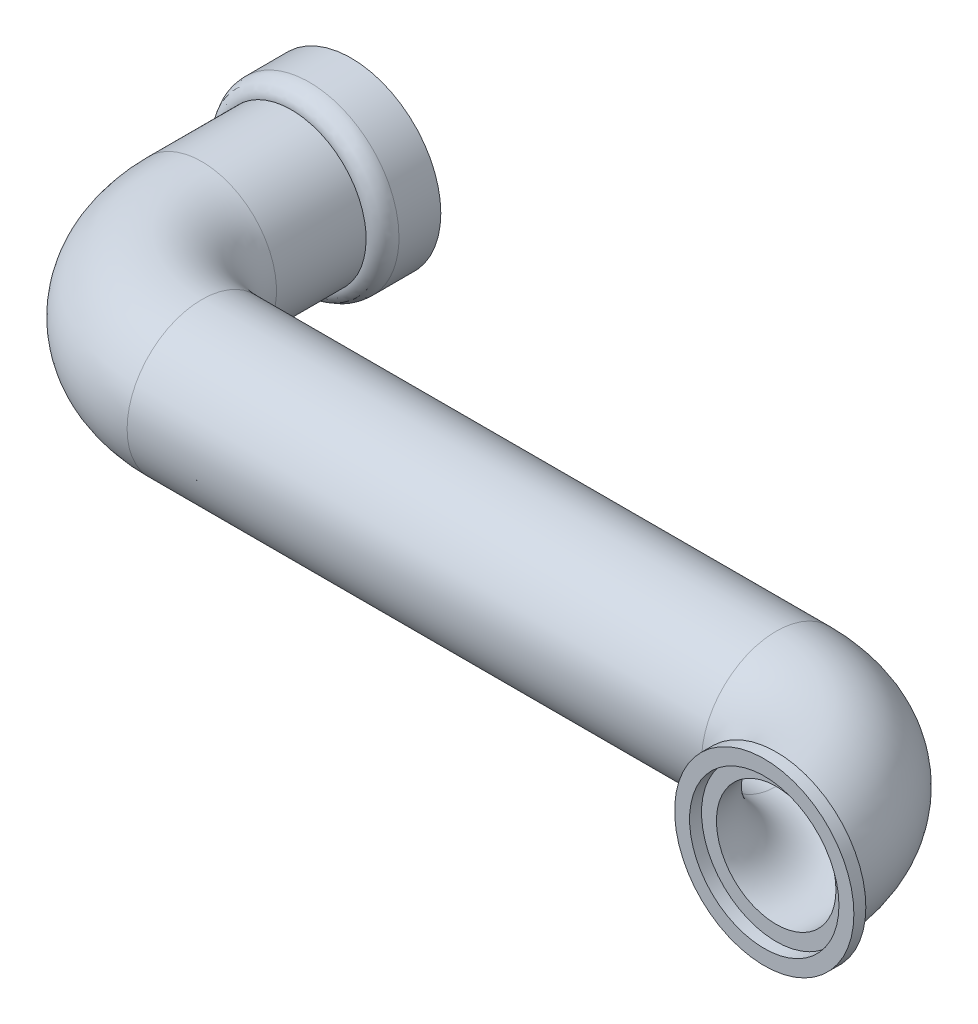
from build123d import *

# Parameters (mm, degrees)
CROQUIS1_R              = 15
CROQUIS1_R_2            = 12.5
SALIENTE_EXTRUIR1_DEPTH = 10
CROQUIS2_R              = 12.5
CROQUIS2_R_2            = 10
SALIENTE_EXTRUIR2_DEPTH = 15
REDONDEO3_SIZE          = 3
REDONDEO3_SIZE_2        = 2.5
SALIENTE_EXTRUIR3_START = 1
CROQUIS3_R              = 12.5
CROQUIS3_R_2            = 10
SALIENTE_EXTRUIR3_DEPTH = 1
CROQUIS6_R              = 12.5
CROQUIS6_R_2            = 10
CROQUIS7_R              = 15
CROQUIS7_R_2            = 12.5
SALIENTE_EXTRUIR4_DEPTH = 2


with BuildPart() as part:
    # Croquis1 → Saliente-Extruir1 (new body)
    with BuildSketch(Plane.XY):
        Circle(CROQUIS1_R)
        Circle(CROQUIS1_R_2, mode=Mode.SUBTRACT)
    extrude(amount=SALIENTE_EXTRUIR1_DEPTH)

    # Redondeo3
    # an asymmetric fillet: 3, 2.5 mm, written as the material it takes off along each edge
    with BuildSketch(Plane(origin=(0, 0, 10), x_dir=(1, 0, 0), z_dir=(0, -1, 0))) as redondeo3_piece_1:
        with BuildLine():
            Bezier((15, -REDONDEO3_SIZE), (15, 0), (15 - REDONDEO3_SIZE_2, 0), weights=[1, 0.707106781, 1])
            Line((15 - REDONDEO3_SIZE_2, 0), (15, 0))
            Line((15, 0), (15, -REDONDEO3_SIZE))
        make_face()
    revolve(axis=Axis((0, 0, 10), (0, 0, 1)), mode=Mode.SUBTRACT)



with BuildPart() as body_2:
    # Croquis2 → Saliente-Extruir2 (new body)
    with BuildSketch(Plane.XY.offset(10)):
        Circle(CROQUIS2_R)
        Circle(CROQUIS2_R_2, mode=Mode.SUBTRACT)
    extrude(amount=SALIENTE_EXTRUIR2_DEPTH)


with BuildPart() as part_1:
    add(part.part)

    add(body_2.part)  # Saliente-Extruir3 merges body 2
    # Croquis3 → Saliente-Extruir3 (add)
    with BuildSketch(Plane(origin=(0, 0, 10), x_dir=(-1, 0, 0), z_dir=(0, 0, -1)).offset(SALIENTE_EXTRUIR3_START)):
        Circle(CROQUIS3_R)
        with Locations(Location((0, 0, 0), (0, 0, 180))):
            Circle(CROQUIS3_R_2, mode=Mode.SUBTRACT)
    extrude(amount=-SALIENTE_EXTRUIR3_DEPTH)

    # Barrer1: sweep along a path in Croquis5
    with BuildLine(Plane(origin=(0, 0, 0), x_dir=(1, 0, 0), z_dir=(0, 1, 0))) as barrer1_path:
        ThreePointArc((0, -25), (5.857864376, -39.142135624), (20, -45))
        Line((20, -45), (116.13, -45))
        ThreePointArc((116.13, -45), (130.272135624, -50.857864376), (136.13, -65))
    # Croquis6 → Barrer1 (sweep)
    with BuildSketch(Plane.XY.offset(25)):
        Circle(CROQUIS6_R)
        Circle(CROQUIS6_R_2, mode=Mode.SUBTRACT)
    sweep(path=barrer1_path.line)


with BuildPart() as body_2_2:
    # Croquis7 → Saliente-Extruir4 (new body)
    with BuildSketch(Plane.XY.offset(65)):
        with Locations((136.13, 0)):
            Circle(CROQUIS7_R)
        with Locations((136.13, 0)):
            Circle(CROQUIS7_R_2, mode=Mode.SUBTRACT)
    extrude(amount=SALIENTE_EXTRUIR4_DEPTH)


solid = Compound([part_1.part, body_2_2.part])
